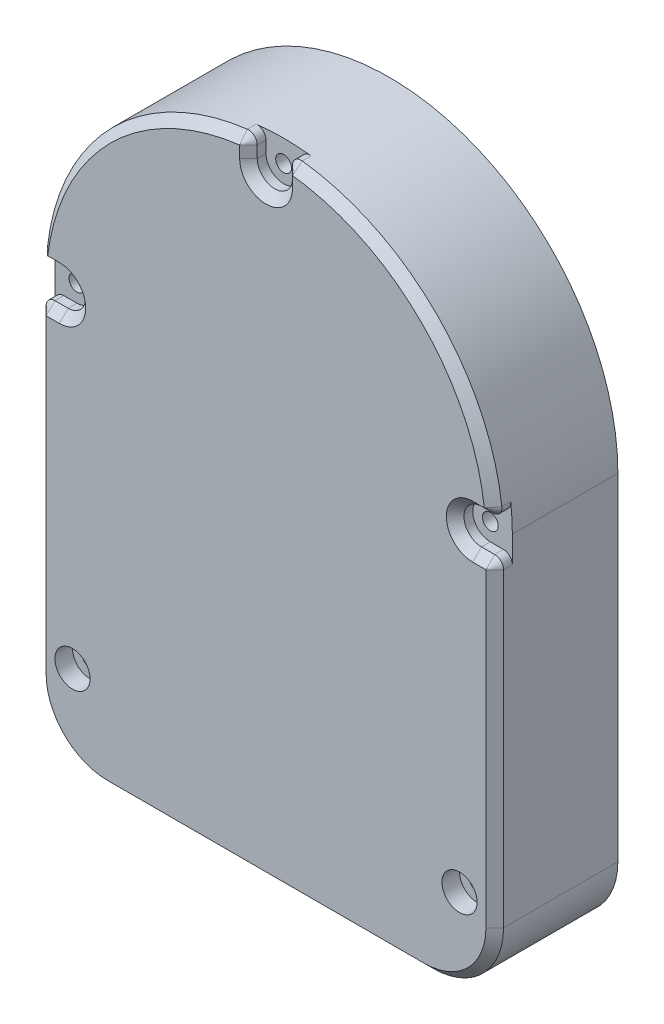
from build123d import *

# Parameters (mm, degrees)
SKETCH_2_R          = 19
SKETCH_2_R_2        = 2.75
EXTRUDE_1_DEPTH     = 14
SKETCH_3_R          = 21.125
CUT_EXTRUDE_1_DEPTH = 12.15
FILLET_1_R          = 8
SKETCH_5_R          = 0.9
CUT_EXTRUDE_3_DEPTH = 61.017185039
SKETCH_6_R          = 21.125
SKETCH_6_R_2        = 2.75
EXTRUDE_2_DEPTH     = 14
CUT_EXTRUDE_4_DEPTH = 13
SKETCH_8_R          = 2
CUT_EXTRUDE_5_DEPTH = 2
FILLET_2_R          = 1
CUT_EXTRUDE_6_REACH = 77.034
CHAMFER_1_SIZE      = 1


with BuildPart() as part:
    # Эскиз2 → Бобышка-Вытянуть1 (new body)
    with BuildSketch(Plane.XY):
        with BuildLine():
            ThreePointArc((26, 26.25), (0, 52.25), (-26, 26.25))
            Line((-26, 26.25), (-26, -20))
            Line((-26, -20), (26, -20))
            Line((26, -20), (26, 26.25))
        make_face()
        with Locations((0, 26.25)):
            Circle(SKETCH_2_R, mode=Mode.SUBTRACT)
        with Locations((12, -10)):
            Circle(SKETCH_2_R_2, mode=Mode.SUBTRACT)
        with Locations((-12, -10)):
            Circle(SKETCH_2_R_2, mode=Mode.SUBTRACT)
    extrude(amount=EXTRUDE_1_DEPTH)

    # Эскиз3 → Вырез-Вытянуть1 (cut)
    with BuildSketch(Plane.XY.offset(14)):
        with Locations((0, 26.25)):
            Circle(SKETCH_3_R)
    extrude(amount=-CUT_EXTRUDE_1_DEPTH, mode=Mode.SUBTRACT)

    # Скругление1
    fillet_1_edges = [part.edges().sort_by_distance(p)[0] for p in [
        (26, -20, 7),
        (-26, -20, 7),
    ]]
    fillet(fillet_1_edges, radius=FILLET_1_R)

    # Эскиз5 → Вырез-Вытянуть3 (cut, through all)
    with BuildSketch(Plane.XY.offset(14)):
        with Locations((0, 49.75)):
            Circle(SKETCH_5_R)
        with Locations((-23.5, 26.25)):
            Circle(SKETCH_5_R)
        with Locations((23.5, 26.25)):
            Circle(SKETCH_5_R)
        with Locations((-22, -10)):
            Circle(SKETCH_5_R)
        with Locations(Location((22, -10, 0), (0, 0, 180))):
            Circle(SKETCH_5_R)
    extrude(amount=-CUT_EXTRUDE_3_DEPTH, mode=Mode.SUBTRACT)

    # Эскиз6 → Бобышка-Вытянуть2 (add, through all)
    with BuildSketch(Plane.XY.offset(14)):
        with Locations((0, 26.25)):
            Circle(SKETCH_6_R)
        with Locations((-12, -10)):
            Circle(SKETCH_6_R_2)
        with Locations((12, -10)):
            Circle(SKETCH_6_R_2)
    extrude(amount=-EXTRUDE_2_DEPTH)

    # Эскиз7 → Вырез-Вытянуть4 (cut)
    with BuildSketch(Plane(origin=(0, 0, 0), x_dir=(-1, 0, 0), z_dir=(0, 0, -1))):
        with BuildLine():
            Line((-23.5, 21.75), (-24, 21.75))
            Line((-24, 21.75), (-24, -5.5))
            Line((-24, -5.5), (-22, -5.5))
            ThreePointArc((-22, -5.5), (-18.818019485, -6.818019485), (-17.5, -10))
            Line((-17.5, -10), (-17.5, -18))
            Line((-17.5, -18), (17.5, -18))
            Line((17.5, -18), (17.5, -10))
            ThreePointArc((17.5, -10), (18.818019485, -6.818019485), (22, -5.5))
            Line((22, -5.5), (24, -5.5))
            Line((24, -5.5), (24, 21.75))
            Line((24, 21.75), (23.5, 21.75))
            ThreePointArc((23.5, 21.75), (20.318019485, 23.068019485), (19, 26.25))
            ThreePointArc((19, 26.25), (0, 45.25), (-19, 26.25))
            ThreePointArc((-19, 26.25), (-20.318019485, 23.068019485), (-23.5, 21.75))
        make_face()
    extrude(amount=-CUT_EXTRUDE_4_DEPTH, mode=Mode.SUBTRACT)

    # Эскиз8 → Вырез-Вытянуть5 (cut)
    with BuildSketch(Plane.XY.offset(14)):
        with Locations((-22, -10)):
            Circle(SKETCH_8_R)
        with Locations((22, -10)):
            Circle(SKETCH_8_R)
        with BuildLine():
            Line((2, 49.75), (2, 52.25))
            Line((2, 52.25), (-2, 52.25))
            Line((-2, 52.25), (-2, 49.75))
            ThreePointArc((-2, 49.75), (0, 47.75), (2, 49.75))
        make_face()
        with BuildLine():
            Line((26, 28.25), (23.5, 28.25))
            ThreePointArc((23.5, 28.25), (21.5, 26.25), (23.5, 24.25))
            Line((23.5, 24.25), (26, 24.25))
            Line((26, 24.25), (26, 28.25))
        make_face()
        with BuildLine():
            Line((-26, 24.25), (-23.5, 24.25))
            ThreePointArc((-23.5, 24.25), (-21.5, 26.25), (-23.5, 28.25))
            Line((-23.5, 28.25), (-26, 28.25))
            Line((-26, 28.25), (-26, 24.25))
        make_face()
    extrude(amount=-CUT_EXTRUDE_5_DEPTH, mode=Mode.SUBTRACT)

    # Скругление2
    fillet_2_edges = [part.edges().sort_by_distance(p)[0] for p in [
        (24, -5.5, 6.5),
        (17.5, -18, 6.5),
        (-17.5, -18, 6.5),
        (-24, -5.5, 6.5),
        (-24, 21.75, 6.5),
        (24, 21.75, 6.5),
        (26, 24.25, 13),
        (25.922962794, 28.25, 13),
        (2, 52.172962794, 13),
        (-2, 52.172962794, 13),
        (-26, 24.25, 13),
        (-25.922962794, 28.25, 13),
    ]]
    fillet(fillet_2_edges, radius=FILLET_2_R)

    # Эскиз9 → Вырез-Вытянуть6 (cut, up to next)
    with BuildSketch(Plane.ZY.offset(26), mode=Mode.PRIVATE) as cut_extrude_6_sk1:
        with BuildLine():
            Line((-7.5, 10.375), (4.5, 10.375))
            ThreePointArc((4.5, 10.375), (6.621320344, 9.496320344), (7.5, 7.375))
            Line((7.5, 7.375), (7.5, 6.875))
            ThreePointArc((7.5, 6.875), (6.621320344, 4.753679656), (4.5, 3.875))
            Line((4.5, 3.875), (-7.5, 3.875))
            Line((-7.5, 3.875), (-7.5, 10.375))
        make_face()
    cut_extrude_6_tool1 = extrude(cut_extrude_6_sk1.sketch, amount=-CUT_EXTRUDE_6_REACH, mode=Mode.PRIVATE) & part.part
    add(cut_extrude_6_tool1.solids().sort_by_distance((-26, 7.125, -0.281755))[0], mode=Mode.SUBTRACT)

    # Фаска1
    chamfer_1_edges = [part.edges().sort_by_distance(p)[0] for p in [
        (2, 50.409673646, 14),
        (0, 47.75, 14),
        (21.5, 26.25, 14),
        (24.25, 24.25, 14),
        (-24.159673646, 28.25, 14),
        (-21.5, 26.25, 14),
        (22.5, -5.5, 13),
        (24, 8.136387212, 13),
        (0, -18, 13),
        (-17.5, -13.5, 13),
        (-24, 8.136387212, 13),
        (-20.176529744, 23.216100619, 13),
        (23.738548946, 21.446974287, 13),
        (-23.738548945, 21.446974288, 13),
        (-23.707106781, -5.207106781, 13),
        (-17.207106781, -17.707106781, 13),
        (17.207106781, -17.707106781, 13),
        (23.707106781, -5.207106781, 13),
        (26, 5.625, 14),
        (-2, 50.409673646, 14),
        (-18.384776311, 44.634776311, 14),
        (-24.25, 24.25, 14),
        (-26, 5.625, 14),
        (24.159673646, 28.25, 14),
        (18.384776311, 44.634776311, 14),
        (-25.567678769, 28.586675042, 14),
        (-25.707106781, 23.957106781, 14),
        (-2.336675042, 51.817678769, 14),
        (2.336675042, 51.817678769, 14),
        (25.567678769, 28.586675042, 14),
        (25.707106781, 23.957106781, 14),
        (0, -20, 14),
        (23.656854249, -17.656854249, 14),
        (-23.656854249, -17.656854249, 14),
        (20.176529744, 23.216100619, 13),
        (0, 45.25, 13),
        (-22.5, -5.5, 13),
        (-18.818019485, -6.818019485, 13),
        (17.5, -13.5, 13),
        (18.818019485, -6.818019485, 13),
    ]]
    chamfer(chamfer_1_edges, length=CHAMFER_1_SIZE - 0.0001)  # a hair under: the kernel refuses the full size


solid = part.part
